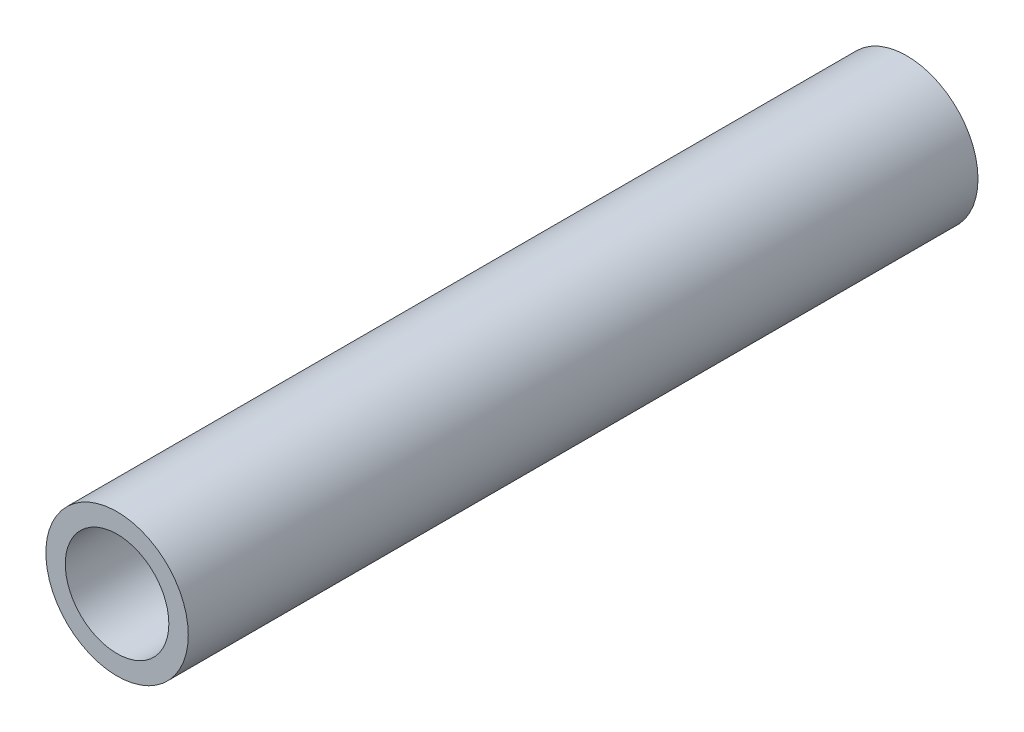
from build123d import *

# Parameters (mm, degrees)
SKETCH1_R           = 27.94
BOSS_EXTRUDE1_DEPTH = 309.88
SKETCH2_R           = 20.32
CUT_EXTRUDE1_DEPTH  = 254
CUT_EXTRUDE2_START  = -50.8
SKETCH3_R           = 20.32
CUT_EXTRUDE2_DEPTH  = 50.8


with BuildPart() as part:
    # Sketch1 → Boss-Extrude1 (new body)
    with BuildSketch(Plane.XY):
        Circle(SKETCH1_R)
    extrude(amount=BOSS_EXTRUDE1_DEPTH)

    # Sketch2 → Cut-Extrude1 (cut)
    with BuildSketch(Plane.XY.offset(309.88)):
        Circle(SKETCH2_R)
    extrude(amount=-CUT_EXTRUDE1_DEPTH, mode=Mode.SUBTRACT)

    # Sketch3 → Cut-Extrude2 (cut)
    with BuildSketch(Plane(origin=(0, 0, 0), x_dir=(-1, 0, 0), z_dir=(0, 0, -1)).offset(CUT_EXTRUDE2_START)):
        Circle(SKETCH3_R)
    extrude(amount=CUT_EXTRUDE2_DEPTH, mode=Mode.SUBTRACT)


solid = part.part
